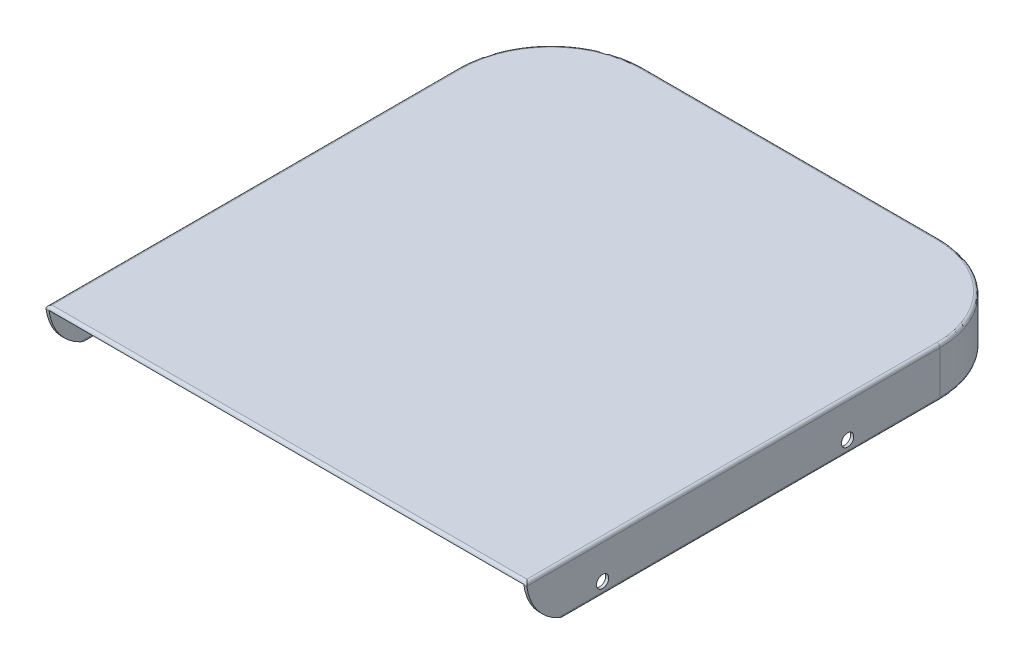
from build123d import *

# Parameters (mm, degrees)
BOSS_EXTRUDE1_DEPTH = 16
CUT_EXTRUDE1_START  = -1
CUT_EXTRUDE1_DEPTH  = 25
SKETCH5_R           = 2.000000000000003
CUT_EXTRUDE3_DEPTH  = 179.07652849266802
CUT_EXTRUDE4_DEPTH  = 179.07652849266802
FILLET1_R           = 1


with BuildPart() as part:
    # Sketch1 → Boss-Extrude1 (new body)
    with BuildSketch(Plane(origin=(0, 0, 0), x_dir=(1, 0, 0), z_dir=(0, 1, 0))):
        with BuildLine():
            Line((-48.499999999999986, 82.49999999999999), (48.500000000000014, 82.50000000000001))
            ThreePointArc((48.500000000000014, 82.50000000000001), (69.71320343559644, 73.71320343559644), (78.5, 52.500000000000014))
            Line((78.5, 52.500000000000014), (78.50000000000003, -82.5))
            Line((78.50000000000003, -82.5), (-78.49999999999997, -82.5))
            Line((-78.49999999999997, -82.5), (-78.5, 52.5))
            ThreePointArc((-78.5, 52.5), (-69.7132034355964, 73.71320343559643), (-48.499999999999986, 82.49999999999999))
        make_face()
    extrude(amount=BOSS_EXTRUDE1_DEPTH)

    # Sketch2 → Cut-Extrude1 (cut)
    with BuildSketch(Plane(origin=(0, 16, 0), x_dir=(1, 0, 0), z_dir=(0, 1, 0)).offset(CUT_EXTRUDE1_START)):
        with BuildLine():
            Line((-47.5, 81.5), (47.50000000000003, 81.50000000000003))
            ThreePointArc((47.50000000000003, 81.50000000000003), (68.71320343559645, 72.71320343559645), (77.50000000000003, 51.50000000000003))
            Line((77.50000000000003, 51.50000000000003), (77.50000000000004, -81.50000000000006))
            Line((77.50000000000004, -81.50000000000006), (77.50000000000006, -82.5))
            Line((77.50000000000006, -82.5), (75.39281372987732, -82.49999999999999))
            Line((75.39281372987732, -82.49999999999999), (-77.49999999999997, -82.5))
            Line((-77.49999999999997, -82.5), (-77.49999999999997, -81.49999999999997))
            Line((-77.49999999999997, -81.49999999999997), (-77.49999999999999, 51.500000000000014))
            ThreePointArc((-77.49999999999999, 51.500000000000014), (-68.71320343559641, 72.71320343559643), (-47.5, 81.5))
        make_face()
    extrude(amount=-CUT_EXTRUDE1_DEPTH, mode=Mode.SUBTRACT)

    # Sketch5 → Cut-Extrude3 (cut, through all)
    with BuildSketch(Plane.ZY.offset(78.49999999999999)):
        with Locations((-22.344222660164835, 4)):
            Circle(SKETCH5_R)
        with Locations((57.65577733983517, 4)):
            Circle(SKETCH5_R)
    extrude(amount=-CUT_EXTRUDE3_DEPTH, mode=Mode.SUBTRACT)

    # Sketch6 → Cut-Extrude4 (cut, through all)
    with BuildSketch(Plane.ZY.offset(78.49999999999999)):
        with BuildLine():
            ThreePointArc((82.49999999999999, 16), (78.51986342800406, 5.952610964746691), (69.49999999999999, -3.55e-15))
            Line((69.49999999999999, 0), (82.49999999999999, 0))
            Line((82.49999999999999, 0), (82.49999999999999, 16))
        make_face()
    extrude(amount=-CUT_EXTRUDE4_DEPTH, mode=Mode.SUBTRACT)

    # Fillet1
    # the kernel refuses this fillet: 1 mm, written as the material it takes off along each edge
    with BuildSketch(Plane(origin=(77.50000000000004, 0, 73.74999999999997), x_dir=(1, 0, -1.1e-16), z_dir=(-1.1e-16, 0, -1)), Plane(origin=(-77.49999999999997, 0, -51.5), x_dir=(-1, 0, 0), z_dir=(0, 0, 1))) as fillet1_piece_1:
        with BuildLine():
            CenterArc((FILLET1_R, -FILLET1_R), FILLET1_R, 90, 90)
            Line((0, -FILLET1_R), (0, 0))
            Line((0, 0), (FILLET1_R, 0))
        make_face()
    extrude(amount=125.25, mode=Mode.SUBTRACT)
    with BuildSketch(Plane(origin=(47.50000000000003, 0, -51.50000000000003), x_dir=(1, 0, 2.4e-16), z_dir=(-2.4e-16, 0, 1))) as fillet1_piece_2:
        with BuildLine():
            CenterArc((30 + FILLET1_R, FILLET1_R), FILLET1_R, 180, 90)
            Line((30, FILLET1_R), (30, 0))
            Line((30, 0), (30 + FILLET1_R, 0))
        make_face()
    revolve(axis=Axis((47.50000000000003, 0, -51.50000000000003), (0, 1, 0)), revolution_arc=90, mode=Mode.SUBTRACT)
    with BuildSketch(Plane(origin=(47.50000000000003, 0, -81.50000000000003), x_dir=(-3e-16, 0, -1), z_dir=(-1, 0, 3e-16))) as fillet1_piece_3:
        with BuildLine():
            CenterArc((FILLET1_R, -FILLET1_R), FILLET1_R, 90, 90)
            Line((0, -FILLET1_R), (0, 0))
            Line((0, 0), (FILLET1_R, 0))
        make_face()
    extrude(amount=95.00000000000003, mode=Mode.SUBTRACT)
    with BuildSketch(Plane(origin=(-47.499999999999986, 0, -51.5), x_dir=(-2.4e-16, 0, -1), z_dir=(1, 0, -2.4e-16))) as fillet1_piece_4:
        with BuildLine():
            CenterArc((30 + FILLET1_R, FILLET1_R), FILLET1_R, 180, 90)
            Line((30, FILLET1_R), (30, 0))
            Line((30, 0), (30 + FILLET1_R, 0))
        make_face()
    revolve(axis=Axis((-47.499999999999986, 0, -51.5), (0, 1, 0)), revolution_arc=89.99999999999994, mode=Mode.SUBTRACT)
    with BuildSketch(Plane(origin=(78.5, 0, -52.500000000000014), x_dir=(-1, 0, 2.1e-16), z_dir=(2.1e-16, 0, 1))) as fillet1_piece_5:
        with BuildLine():
            CenterArc((FILLET1_R, -FILLET1_R), FILLET1_R, 90, 90)
            Line((0, -FILLET1_R), (0, 0))
            Line((0, 0), (FILLET1_R, 0))
        make_face()
    extrude(amount=126.24999999999999, mode=Mode.SUBTRACT)
    with BuildSketch(Plane(origin=(48.50000000000004, 0, -52.50000000000006), x_dir=(-9.5e-16, 0, -1), z_dir=(-1, 0, 9.5e-16))) as fillet1_piece_6:
        with BuildLine():
            CenterArc((29.999999999999943 - FILLET1_R, -FILLET1_R), FILLET1_R, 1.272e-14, 90)
            Line((29.999999999999943, -FILLET1_R), (29.999999999999943, 0))
            Line((29.999999999999943, 0), (29.999999999999943 - FILLET1_R, 0))
        make_face()
    revolve(axis=Axis((48.50000000000004, 0, -52.50000000000006), (0, -1, 0)), revolution_arc=90.00000000000014, mode=Mode.SUBTRACT)
    with BuildSketch(Plane(origin=(-48.499999999999986, 0, -82.49999999999999), x_dir=(0, 1, 0), z_dir=(1, 0, -2.9e-16))) as fillet1_piece_7:
        with BuildLine():
            CenterArc((FILLET1_R, FILLET1_R), FILLET1_R, 180, 90)
            Line((-1.1e-16, FILLET1_R), (0, 0))
            Line((0, 0), (FILLET1_R, 0))
        make_face()
    extrude(amount=97, mode=Mode.SUBTRACT)
    with BuildSketch(Plane(origin=(-48.49999999999997, 0, -52.49999999999995), x_dir=(-1, 0, -1.66e-15), z_dir=(-1.66e-15, 0, 1))) as fillet1_piece_8:
        with BuildLine():
            CenterArc((30.00000000000003 - FILLET1_R, -FILLET1_R), FILLET1_R, 0, 90)
            Line((30.00000000000003 - FILLET1_R, 1.1e-16), (30.00000000000003, 0))
            Line((30.00000000000003, 0), (30.00000000000003, -FILLET1_R))
        make_face()
    revolve(axis=Axis((-48.49999999999997, 0, -52.49999999999995), (0, -1, 0)), revolution_arc=89.99999999999989, mode=Mode.SUBTRACT)
    with BuildSketch(Plane(origin=(-78.49999999999997, 16, 85), x_dir=(0, -1, 0), z_dir=(-2.1e-16, 0, -1))) as fillet1_piece_9:
        with BuildLine():
            CenterArc((FILLET1_R, -FILLET1_R), FILLET1_R, 90, 90)
            Line((0, -FILLET1_R), (0, 0))
            Line((0, 0), (FILLET1_R, 0))
        make_face()
    extrude(amount=137.5, mode=Mode.SUBTRACT)
    with BuildSketch(Plane(origin=(-48.49999999999997, 16, -52.49999999999995), x_dir=(-1, 0, -1.66e-15), z_dir=(-1.66e-15, 0, 1))) as fillet1_piece_10:
        with BuildLine():
            CenterArc((30.00000000000003 - FILLET1_R, FILLET1_R), FILLET1_R, 270, 90)
            Line((30.00000000000003 - FILLET1_R, 0), (30.00000000000003, 0))
            Line((30.00000000000003, 0), (30.00000000000003, FILLET1_R))
        make_face()
    revolve(axis=Axis((-48.49999999999997, 16, -52.49999999999995), (0, -1, 0)), revolution_arc=89.99999999999989, mode=Mode.SUBTRACT)
    with BuildSketch(Plane(origin=(-48.499999999999986, 16, -82.49999999999999), x_dir=(0, -1, 0), z_dir=(1, 0, -2.9e-16))) as fillet1_piece_11:
        with BuildLine():
            CenterArc((FILLET1_R, -FILLET1_R), FILLET1_R, 90, 90)
            Line((0, -FILLET1_R), (0, 0))
            Line((0, 0), (FILLET1_R, 0))
        make_face()
    extrude(amount=97, mode=Mode.SUBTRACT)
    with BuildSketch(Plane(origin=(48.50000000000004, 16, -52.50000000000006), x_dir=(-9.5e-16, 0, -1), z_dir=(-1, 0, 9.5e-16))) as fillet1_piece_12:
        with BuildLine():
            CenterArc((29.999999999999943 - FILLET1_R, FILLET1_R), FILLET1_R, 270, 90)
            Line((29.999999999999943, FILLET1_R), (29.999999999999943, 0))
            Line((29.999999999999943, 0), (29.999999999999943 - FILLET1_R, 0))
        make_face()
    revolve(axis=Axis((48.50000000000004, 16, -52.50000000000006), (0, -1, 0)), revolution_arc=90.00000000000014, mode=Mode.SUBTRACT)
    with BuildSketch(Plane(origin=(78.5, 16, -52.500000000000014), x_dir=(-1, 0, 2.1e-16), z_dir=(2.1e-16, 0, 1))) as fillet1_piece_13:
        with BuildLine():
            CenterArc((FILLET1_R, FILLET1_R), FILLET1_R, 180, 90)
            Line((0, FILLET1_R), (0, 0))
            Line((0, 0), (FILLET1_R, 0))
        make_face()
    extrude(amount=137.5, mode=Mode.SUBTRACT)
    with BuildSketch(Plane(origin=(-78.49999999999997, 0, 73.75), x_dir=(0, 1, 0), z_dir=(-2.1e-16, 0, -1))) as fillet1_piece_14:
        with BuildLine():
            CenterArc((FILLET1_R, FILLET1_R), FILLET1_R, 180, 90)
            Line((-1.1e-16, FILLET1_R), (0, 0))
            Line((0, 0), (FILLET1_R, 0))
        make_face()
    extrude(amount=126.25, mode=Mode.SUBTRACT)
    with BuildSketch(Plane(origin=(81.35302601856634, 16, 82.5), x_dir=(0, 0, -1), z_dir=(-1, 0, 0))) as fillet1_piece_15:
        with BuildLine():
            CenterArc((1.1090314143661004, 1), FILLET1_R, 172.23715283019968, 97.76284716980035)
            ThreePointArc((0.11819577889333743, 1.135073104196561), (0.05009298550456265, 0.5684742376371492), (0, 0))
            Line((0, 0), (1.1090314143661004, 0))
        make_face()
    extrude(amount=162.70605203713265, mode=Mode.SUBTRACT)


solid = part.part
